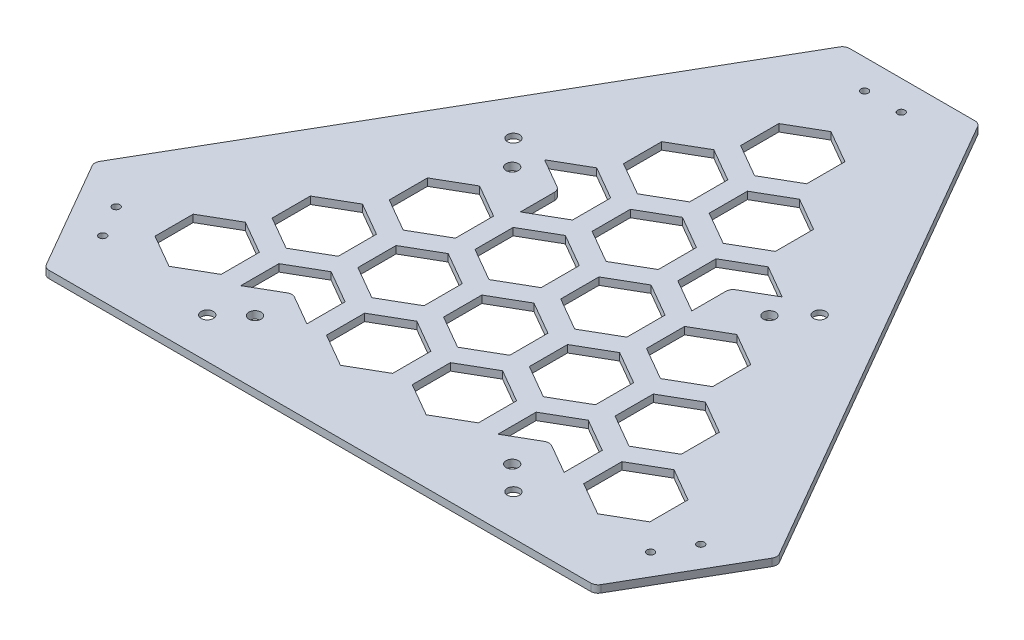
from build123d import *

# Parameters (mm, degrees)
EXTRUDE_1_DEPTH     = 3
SKETCH_3_R          = 2.5
CUT_EXTRUDE_1_DEPTH = 202.639157145
SKETCH_4_R          = 5.5
CUT_EXTRUDE_2_DEPTH = 1
CUT_EXTRUDE_3_DEPTH = 202.639157145
F_3_0MM_1_D         = 3
FILLET_1_R          = 3
F_5_0MM_1_D         = 5


with BuildPart() as part:
    # 草圖1 → 填料-伸長1 (new body)
    with BuildSketch(Plane(origin=(0, 0, 0), x_dir=(1, 0, 0), z_dir=(0, 1, 0))):
        Polygon((112.309401, -96.376042937), (139.618802, -49.074772881), (27.309401, 145.450815819), (-27.309401, 145.450815819), (-139.618802, -49.074772881), (-112.309401, -96.376042937), align=None)
    extrude(amount=-EXTRUDE_1_DEPTH)

    # 草圖3 → 除料-伸長1 (cut, through all)
    with BuildSketch(Plane(origin=(0, 0, 0), x_dir=(1, 0, 0), z_dir=(0, 1, 0))):
        with Locations((-62.5, 45.123957063)):
            Circle(SKETCH_3_R)
        with Locations((62.5, 45.123957063)):
            Circle(SKETCH_3_R)
        with Locations((-62.5, -79.876042937)):
            Circle(SKETCH_3_R)
        with Locations((62.5, -79.876042937)):
            Circle(SKETCH_3_R)
    extrude(amount=-CUT_EXTRUDE_1_DEPTH, mode=Mode.SUBTRACT)

    # 草圖4 → 除料-伸長2 (cut)
    with BuildSketch(Plane.XZ.offset(3)):
        with Locations((-62.5, 79.876042937)):
            Circle(SKETCH_4_R)
        with Locations((62.5, 79.876042937)):
            Circle(SKETCH_4_R)
        with Locations((62.5, -45.123957063)):
            Circle(SKETCH_4_R)
        with Locations((-62.5, -45.123957063)):
            Circle(SKETCH_4_R)
    extrude(amount=-CUT_EXTRUDE_2_DEPTH, mode=Mode.SUBTRACT)

    # 草圖5 → 除料-伸長3 (cut, through all)
    with BuildSketch(Plane(origin=(0, 0, 0), x_dir=(1, 0, 0), z_dir=(0, 1, 0))):
        Polygon((-35, -40.176914536), (-21.5, -32.382685902), (-21.5, -16.794228634), (-35, -9), (-48.5, -16.794228634), (-48.5, -32.382685902), align=None)
        Polygon((0, -40.176914536), (13.5, -32.382685902), (13.5, -16.794228634), (0, -9), (-13.5, -16.794228634), (-13.5, -32.382685902), align=None)
        Polygon((-70, -40.176914536), (-56.5, -32.382685902), (-56.5, -16.794228634), (-70, -9), (-83.5, -16.794228634), (-83.5, -32.382685902), align=None)
        Polygon((-17.5, -9.866025404), (-4, -2.07179677), (-4, 13.516660498), (-17.5, 21.310889132), (-31, 13.516660498), (-31, -2.07179677), align=None)
        Polygon((-52.5, -9.866025404), (-39, -2.07179677), (-39, 13.516660498), (-52.5, 21.310889132), (-66, 13.516660498), (-66, -2.07179677), align=None)
        Polygon((0, 20.444863729), (13.5, 28.239092363), (13.5, 43.827549631), (0, 51.621778265), (-13.5, 43.827549631), (-13.5, 28.239092363), align=None)
        Polygon((-35, 20.444863729), (-21.5, 28.239092363), (-21.5, 43.827549631), (-35, 51.621778265), (-48.5, 43.827549631), (-35, 36.033320997), align=None)
        Polygon((17.5, 50.755752861), (31, 58.549981495), (31, 74.138438763), (17.5, 81.932667397), (4, 74.138438763), (4, 58.549981495), align=None)
        Polygon((-17.5, 50.755752861), (-4, 58.549981495), (-4, 74.138438763), (-17.5, 81.932667397), (-31, 74.138438763), (-31, 58.549981495), align=None)
        Polygon((0, 81.066641994), (13.5, 88.860870628), (13.5, 104.449327896), (0, 112.24355653), (-13.5, 104.449327896), (-13.5, 88.860870628), align=None)
        Polygon((48.5, 43.827549631), (35, 51.621778265), (21.5, 43.827549631), (21.5, 28.239092363), (35, 20.444863729), (35, 36.033320997), align=None)
        Polygon((52.5, -9.866025404), (66, -2.07179677), (66, 13.516660498), (52.5, 21.310889132), (39, 13.516660498), (39, -2.07179677), align=None)
        Polygon((17.5, -9.866025404), (31, -2.07179677), (31, 13.516660498), (17.5, 21.310889132), (4, 13.516660498), (4, -2.07179677), align=None)
        Polygon((35, -40.176914536), (48.5, -32.382685902), (48.5, -16.794228634), (35, -9), (21.5, -16.794228634), (21.5, -32.382685902), align=None)
        Polygon((70, -40.176914536), (83.5, -32.382685902), (83.5, -16.794228634), (70, -9), (56.5, -16.794228634), (56.5, -32.382685902), align=None)
        Polygon((17.5, -70.487803669), (31, -62.693575035), (31, -47.105117767), (17.5, -39.310889132), (4, -47.105117767), (4, -62.693575035), align=None)
        Polygon((66, -62.693575035), (66, -47.105117767), (52.5, -39.310889132), (39, -47.105117767), (39, -62.693575035), (52.5, -54.899346401), align=None)
        Polygon((87.5, -70.487803669), (101, -62.693575035), (101, -47.105117767), (87.5, -39.310889132), (74, -47.105117767), (74, -62.693575035), align=None)
        Polygon((-17.5, -70.487803669), (-4, -62.693575035), (-4, -47.105117767), (-17.5, -39.310889132), (-31, -47.105117767), (-31, -62.693575035), align=None)
        Polygon((-39, -62.693575035), (-39, -47.105117767), (-52.5, -39.310889132), (-66, -47.105117767), (-66, -62.693575035), (-52.5, -54.899346401), align=None)
        Polygon((-87.5, -70.487803669), (-74, -62.693575035), (-74, -47.105117767), (-87.5, -39.310889132), (-101, -47.105117767), (-101, -62.693575035), align=None)
    extrude(amount=-CUT_EXTRUDE_3_DEPTH, mode=Mode.SUBTRACT)

    # Ø3.0mm 定位孔1 (through all)
    with Locations(Plane(origin=(111.821796655, -3, 73.220598438), x_dir=(0, 0, -1), z_dir=(0, -1, 0))):
        with Locations((0, 0), (12.990381057, 7.5), (206.671414257, -104.321796655), (206.671414257, -119.321796655), (0, -223.64359331), (12.990381057, -231.14359331)):
            Hole(F_3_0MM_1_D / 2)

    # 圓角1
    fillet_1_edges = [part.edges().sort_by_distance(p)[0] for p in [
        (139.618802, -1.5, 49.074772881),
        (112.309401, -1.5, 96.376042937),
        (-112.309401, -1.5, 96.376042937),
        (-139.618802, -1.5, 49.074772881),
        (-27.309401, -1.5, -145.450815819),
        (27.309401, -1.5, -145.450815819),
        (-52.5, -1.5, 54.899346401),
        (52.5, -1.5, 54.899346401),
        (35, -1.5, -36.033320997),
        (-35, -1.5, -36.033320997),
    ]]
    fillet(fillet_1_edges, radius=FILLET_1_R)

    # Ø5.0mm 定位孔1 (through all)
    with Locations(Plane(origin=(-52.5, 0, -34.623957063), x_dir=(0, 0, 1), z_dir=(0, 1, 0))):
        with Locations((0, 0), (0, 105), (105, 105), (105, 0)):
            Hole(F_5_0MM_1_D / 2)


solid = part.part
